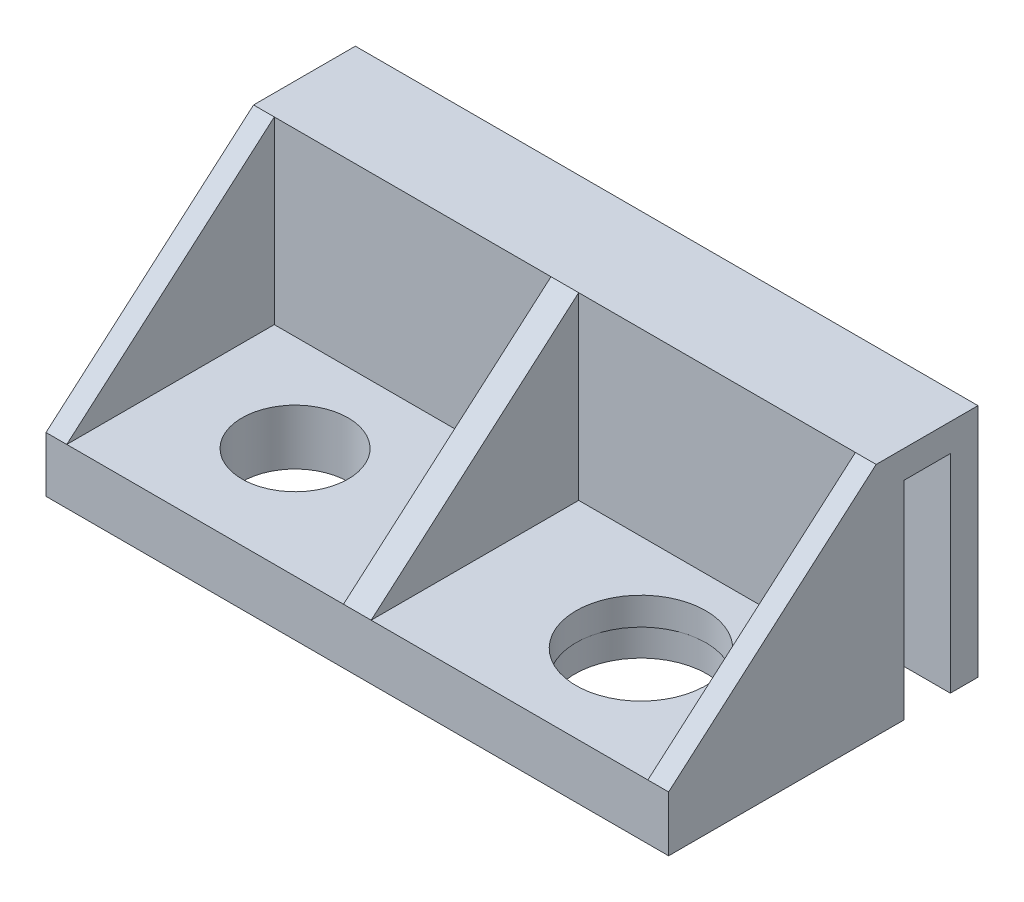
from build123d import *

# Parameters (mm, degrees)
BOSS_EXTRUDE1_DEPTH = 22.5
SKETCH2_W           = 3.36
SKETCH2_H           = 28
CUT_EXTRUDE1_DEPTH  = 54.046862301
SKETCH3_W           = 7.36
SKETCH3_H           = 13
CUT_EXTRUDE2_DEPTH  = 54.046862301
SKETCH4_R           = 4.69
SKETCH4_R_2         = 3.835
CUT_EXTRUDE3_DEPTH  = 10
SKETCH6_R           = 4.775
CUT_EXTRUDE5_DEPTH  = 2
RIB2_REACH          = 55.047
SKETCH7_WALL_W      = 127.943157844
SKETCH7_WALL_H      = 1.5
RIB3_REACH          = 55.047
SKETCH8_WALL_W      = 127.943157844
SKETCH8_WALL_H      = 1.5
RIB4_REACH          = 37.989
SKETCH9_WALL_W      = 93.8277522
SKETCH9_WALL_H      = 2


with BuildPart() as part:
    # Sketch1 → Boss-Extrude1 (new, symmetric)
    with BuildSketch(Plane(origin=(0, 0, 0), x_dir=(0, 0, -1), z_dir=(1, 0, 0))):
        Polygon((0, -13), (0, 17), (-7.36, 17), (-7.36, 4), (-22.36, 4), (-22.36, 0), (-7.36, 0), (-7.36, -13), align=None)
    extrude(amount=BOSS_EXTRUDE1_DEPTH, both=True)

    # Sketch2 → Cut-Extrude1 (cut, through all)
    with BuildSketch(Plane(origin=(22.5, 0, 0), x_dir=(0, 0, -1), z_dir=(1, 0, 0))):
        with Locations((-3.68, 1)):
            Rectangle(SKETCH2_W, SKETCH2_H)
    extrude(amount=-CUT_EXTRUDE1_DEPTH, mode=Mode.SUBTRACT)

    # Sketch3 → Cut-Extrude2 (cut, through all)
    with BuildSketch(Plane(origin=(22.5, 0, 0), x_dir=(0, 0, -1), z_dir=(1, 0, 0))):
        with Locations((-3.68, -6.5)):
            Rectangle(SKETCH3_W, SKETCH3_H)
    extrude(amount=-CUT_EXTRUDE2_DEPTH, mode=Mode.SUBTRACT)

    # Sketch4 → Cut-Extrude3 (cut)
    with BuildSketch(Plane(origin=(0, 0, 0), x_dir=(-1, 0, 0), z_dir=(0, -1, 0))):
        with Locations((-12.5, -14.36)):
            Circle(SKETCH4_R)
        with Locations((12.5, -14.36)):
            Circle(SKETCH4_R_2)
    extrude(amount=-CUT_EXTRUDE3_DEPTH, mode=Mode.SUBTRACT)

    # Sketch6 → Cut-Extrude5 (cut)
    with BuildSketch(Plane(origin=(0, 0, 0), x_dir=(-1, 0, 0), z_dir=(0, -1, 0))):
        with Locations((-12.5, -14.36)):
            Circle(SKETCH6_R)
    extrude(amount=-CUT_EXTRUDE5_DEPTH, mode=Mode.SUBTRACT)

    # Sketch7 wall → Rib2 (add, up to next)
    with BuildSketch(Plane(origin=(-22.5, 10.5, 14.86), x_dir=(0, 0.654930538418, -0.75568908279), z_dir=(0, -0.75568908279, -0.654930538418)), mode=Mode.PRIVATE) as rib2_sk1:
        with Locations((0, 0.75)):
            Rectangle(SKETCH7_WALL_W, SKETCH7_WALL_H)
    rib2_tool1 = extrude(rib2_sk1.sketch, amount=RIB2_REACH, mode=Mode.PRIVATE) - part.part
    add(rib2_tool1.solids().sort_by_distance((-22.5, 10.5, 14.86))[0])

    # Sketch8 wall → Rib3 (add, up to next)
    with BuildSketch(Plane(origin=(22.5, 10.5, 14.86), x_dir=(0, 0.654930538418, -0.75568908279), z_dir=(0, 0.75568908279, 0.654930538418)), mode=Mode.PRIVATE) as rib3_sk1:
        with Locations((0, 0.75)):
            Rectangle(SKETCH8_WALL_W, SKETCH8_WALL_H)
    rib3_tool1 = extrude(rib3_sk1.sketch, amount=-RIB3_REACH, mode=Mode.PRIVATE) - part.part
    add(rib3_tool1.solids().sort_by_distance((22.5, 10.5, 14.86))[0])

    # Sketch9 wall → Rib4 (add, up to next)
    with BuildSketch(Plane(origin=(0, 10.5, 14.86), x_dir=(0, 0.654930538418, -0.75568908279), z_dir=(0, 0.75568908279, 0.654930538418)), mode=Mode.PRIVATE) as rib4_sk1:
        Rectangle(SKETCH9_WALL_W, SKETCH9_WALL_H)
    rib4_tool1 = extrude(rib4_sk1.sketch, amount=-RIB4_REACH, mode=Mode.PRIVATE) - part.part
    add(rib4_tool1.solids().sort_by_distance((0, 10.5, 14.86))[0])


solid = part.part
